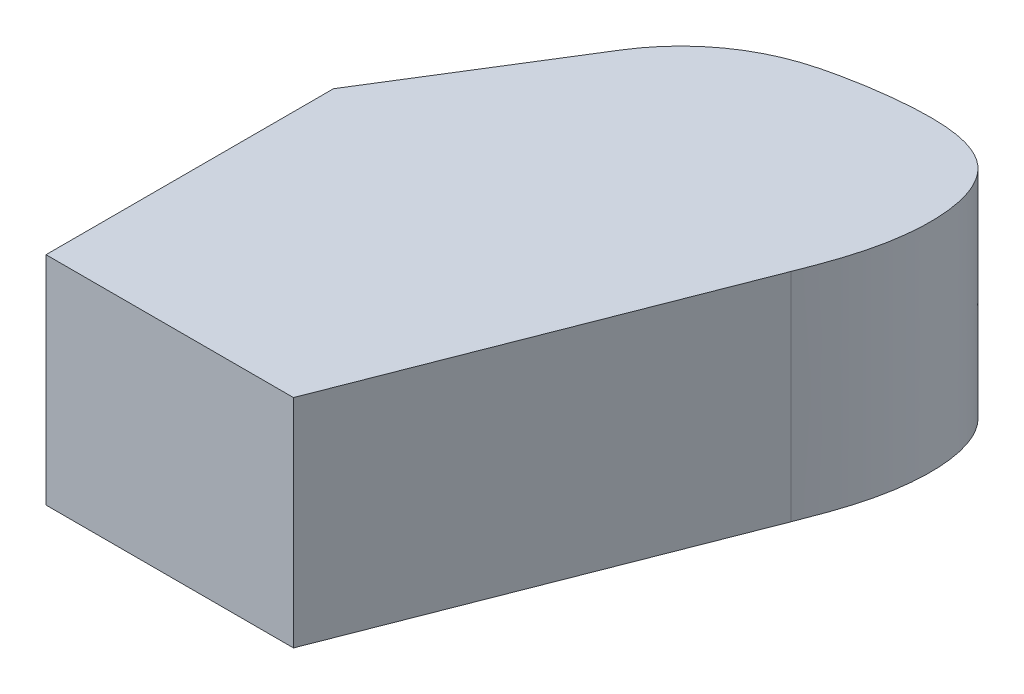
from build123d import *

# Parameters (mm, degrees)
BOSS_EXTRUDE1_DEPTH = 58.42
FILLET9_START       = -1
FILLET9_DEPTH       = 60
FILLET9_2_DEPTH     = 58.42


with BuildPart() as part:
    # Sketch1 → Boss-Extrude1 (new body)
    with BuildSketch(Plane(origin=(0, 0, 0), x_dir=(1, 0, 0), z_dir=(0, 1, 0))):
        with BuildLine():
            Line((-66.673768512, 0), (-37.067821873, 47.633329988))
            ThreePointArc((-37.067821873, 47.633329988), (-11.329209284, 68.541566023), (21.82652777, 69.113940477))
            Line((21.82652777, 69.113940477), (53.138492197, 58.903517294))
            Line((53.138492197, 58.903517294), (0, -77.45185891))
            Line((0, -77.45185891), (-66.673768512, -77.45185891))
            Line((-66.673768512, -77.45185891), (-66.673768512, 0))
        make_face()
    extrude(amount=BOSS_EXTRUDE1_DEPTH)

    # Fillet9: read off the stored shape, not the designer's step
    # Fillet9 outline → Fillet9 (cut)
    with BuildSketch(Plane(origin=(0, 0, 0), x_dir=(1, 0, 0), z_dir=(0, 1, 0)).offset(FILLET9_START)):
        with BuildLine():
            Line((53.138492197, 58.903517294), (42.560128995, 62.352983555))
            add(Edge.make_bspline(
                [(42.560128995, 62.352983555), (45.276451429, 55.785497085), (45.88017533, 47.021967979), (44.583604834, 36.951353495), (41.094604397, 27.998446712), (37.605603959, 19.045539929)],
                knots=[0.582099673, 0.582099673, 0.582099673, 0.582099673, 0.582099673, 0.582099673, 1, 1, 1, 1, 1, 1], degree=5))
            Line((37.605603959, 19.045539929), (53.138492197, 58.903517294))
        make_face()
    extrude(amount=FILLET9_DEPTH, mode=Mode.SUBTRACT)

    # Fillet9 2 outline → Fillet9 2 (add)
    with BuildSketch(Plane(origin=(0, 0, 0), x_dir=(1, 0, 0), z_dir=(0, 1, 0))):
        with BuildLine():
            add(Edge.make_bspline(
                [(-9.808315325, 69.069133652), (-0.482865879, 72.139293798), (12.240866744, 73.831219733), (27.210316696, 75.821767739), (36.460068296, 72.746962644), (41.411307971, 64.848690609), (42.026486953, 63.643215838), (42.560128995, 62.352983555)],
                knots=[0, 0, 0, 0, 0, 0, 0.5, 0.5, 0.582099673, 0.582099673, 0.582099673, 0.582099673, 0.582099673, 0.582099673], degree=5))
            ThreePointArc((-9.808315325, 69.069133652), (6.005529482, 71.616813676), (21.82652777, 69.113940477))
            Line((21.82652777, 69.113940477), (42.560128995, 62.352983555))
        make_face()
    extrude(amount=FILLET9_2_DEPTH)


solid = part.part
